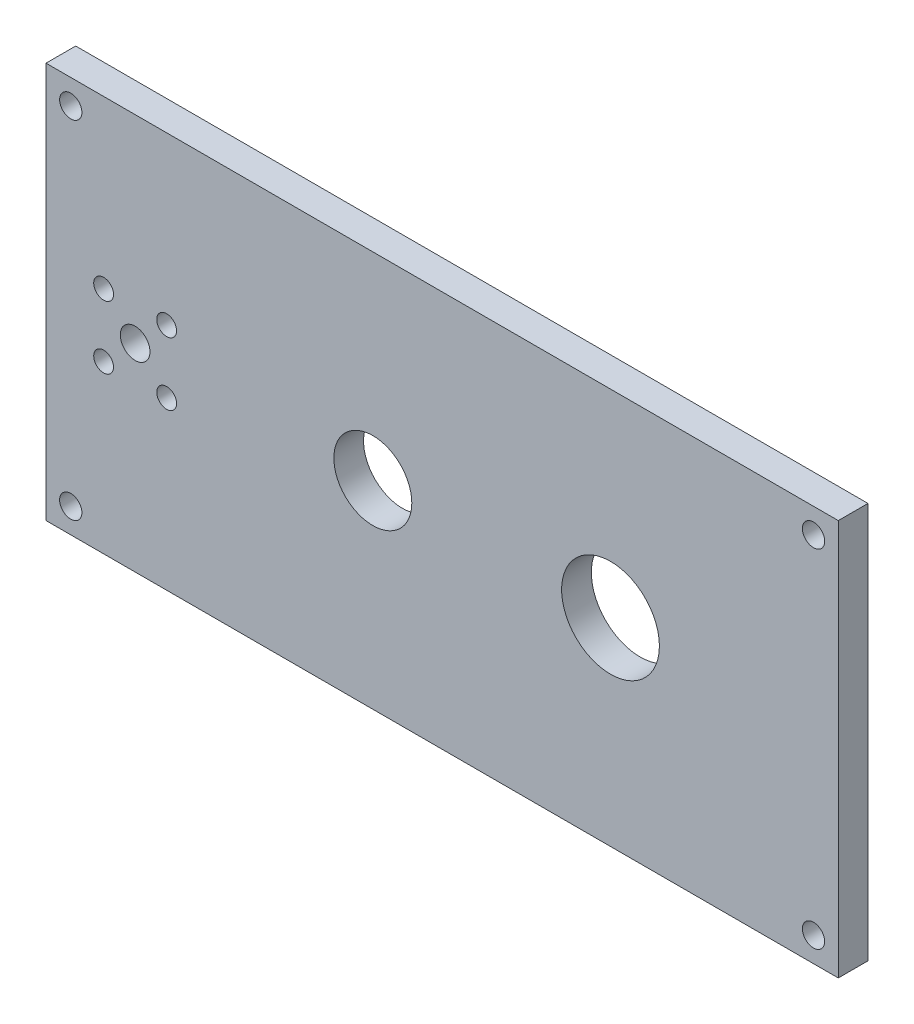
from build123d import *

# Parameters (mm, degrees)
SKETCH1_W           = 80
SKETCH1_H           = 40
BOSS_EXTRUDE1_DEPTH = 3
SKETCH2_R           = 3.9365
SKETCH2_R_2         = 4.9365
SKETCH2_R_3         = 1
SKETCH2_R_4         = 1.125
SKETCH2_R_5         = 1.5
CUT_EXTRUDE1_DEPTH  = 90.493016487


with BuildPart() as part:
    # Sketch1 → Boss-Extrude1 (new body)
    with BuildSketch(Plane.XY):
        with Locations((40, 20)):
            Rectangle(SKETCH1_W, SKETCH1_H)
    extrude(amount=BOSS_EXTRUDE1_DEPTH)

    # Sketch2 → Cut-Extrude1 (cut, through all)
    with BuildSketch(Plane.XY.offset(3)):
        with Locations((33, 20)):
            Circle(SKETCH2_R)
        with Locations((57, 20)):
            Circle(SKETCH2_R_2)
        with Locations((12.181980515, 23.181980515)):
            Circle(SKETCH2_R_3)
        with Locations((12.181980515, 16.818019485)):
            Circle(SKETCH2_R_3)
        with Locations((5.818019485, 16.818019485)):
            Circle(SKETCH2_R_3)
        with Locations((5.818019485, 23.181980515)):
            Circle(SKETCH2_R_3)
        with Locations((2.5, 37.5)):
            Circle(SKETCH2_R_4)
        with Locations((77.5, 37.5)):
            Circle(SKETCH2_R_4)
        with Locations((77.5, 2.5)):
            Circle(SKETCH2_R_4)
        with Locations((2.5, 2.5)):
            Circle(SKETCH2_R_4)
        with Locations((9, 20)):
            Circle(SKETCH2_R_5)
    extrude(amount=-CUT_EXTRUDE1_DEPTH, mode=Mode.SUBTRACT)


solid = part.part
